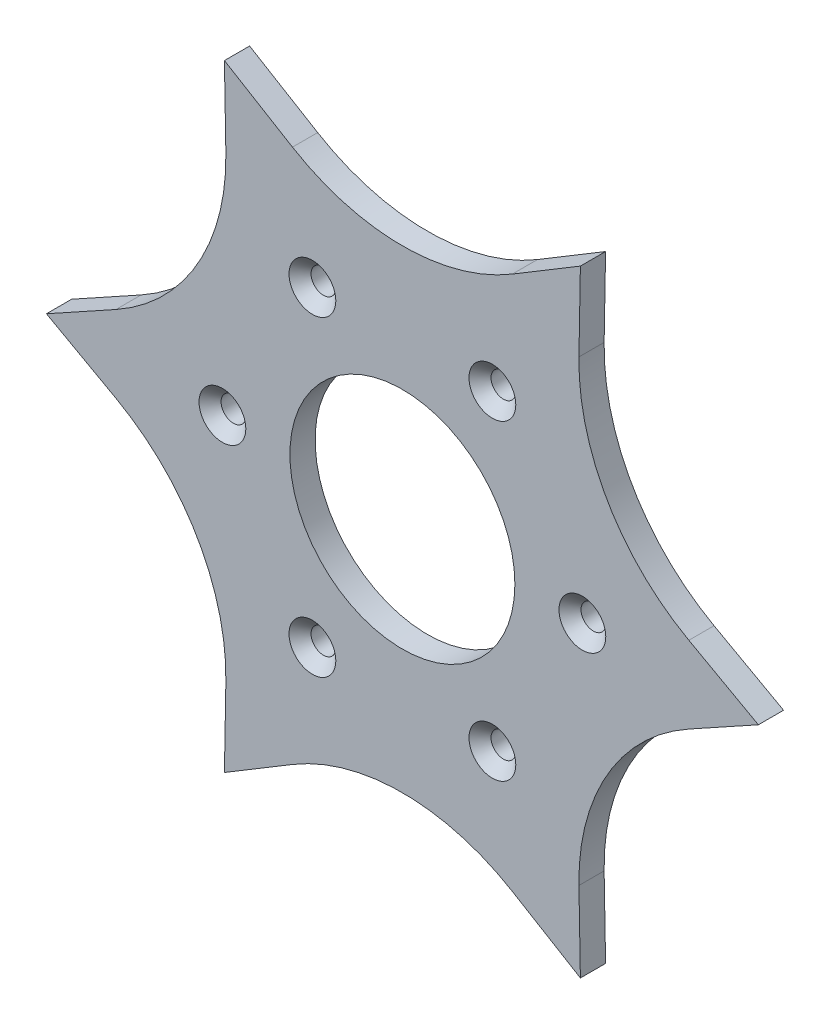
from build123d import *

# Parameters (mm, degrees)
SKETCH7_R                                       = 25
BOSS_EXTRUDE5_DEPTH                             = 5.6
CSK_FOR_M5_FLAT_HEAD_MACHINE_SCREW1_D           = 5.5
CSK_FOR_M5_FLAT_HEAD_MACHINE_SCREW1_CSINK_D     = 10.4
CSK_FOR_M5_FLAT_HEAD_MACHINE_SCREW1_CSINK_ANGLE = 90
CIRPATTERN1_COUNT                               = 6


with BuildPart() as part:
    # Sketch7 → Boss-Extrude5 (new body)
    with BuildSketch(Plane.XY.offset(62.545612614)):
        with BuildLine():
            Line((-39.235419436, -50.863989919), (-39.557386288, -68.515402865))
            Line((-39.557386288, -68.515402865), (-24.43179769, -59.410864919))
            ThreePointArc((-24.43179769, -59.410864919), (0, -52.625), (24.43179769, -59.410864919))
            Line((24.43179769, -59.410864919), (39.557386288, -68.515402865))
            Line((39.557386288, -68.515402865), (39.235419436, -50.863989919))
            ThreePointArc((39.235419436, -50.863989919), (45.574586874, -26.3125), (63.667217125, -8.546875))
            Line((63.667217125, -8.546875), (79.114772576, 0))
            Line((79.114772576, 0), (63.667217125, 8.546875))
            ThreePointArc((63.667217125, 8.546875), (45.574586874, 26.3125), (39.235419436, 50.863989919))
            Line((39.235419436, 50.863989919), (39.557386288, 68.515402865))
            Line((39.557386288, 68.515402865), (24.43179769, 59.410864919))
            ThreePointArc((24.43179769, 59.410864919), (0, 52.625), (-24.43179769, 59.410864919))
            Line((-24.43179769, 59.410864919), (-39.557386288, 68.515402865))
            Line((-39.557386288, 68.515402865), (-39.235419436, 50.863989919))
            ThreePointArc((-39.235419436, 50.863989919), (-45.574586874, 26.3125), (-63.667217125, 8.546875))
            Line((-63.667217125, 8.546875), (-79.114772576, 0))
            Line((-79.114772576, 0), (-63.667217125, -8.546875))
            ThreePointArc((-63.667217125, -8.546875), (-45.574586874, -26.3125), (-39.235419436, -50.863989919))
        make_face()
        Circle(SKETCH7_R, mode=Mode.SUBTRACT)
    extrude(amount=BOSS_EXTRUDE5_DEPTH)

    # CSK for M5 Flat Head Machine Screw1 (through all)
    with Locations(Plane.XY.offset(68.145612614)):
        with Locations((-40, 0)):
            csk_for_m5_flat_head_machine_screw1 = CounterSinkHole(CSK_FOR_M5_FLAT_HEAD_MACHINE_SCREW1_D / 2, CSK_FOR_M5_FLAT_HEAD_MACHINE_SCREW1_CSINK_D / 2, counter_sink_angle=CSK_FOR_M5_FLAT_HEAD_MACHINE_SCREW1_CSINK_ANGLE)

    # CirPattern1: CSK for M5 Flat Head Machine Screw1 ×6 about axis
    cirpattern1_axis = Axis((0, 0, 68.145612614), (0, 0, 1))
    for i in range(1, CIRPATTERN1_COUNT):
        add(csk_for_m5_flat_head_machine_screw1.rotate(cirpattern1_axis, i * 360 / CIRPATTERN1_COUNT), mode=Mode.SUBTRACT)


solid = part.part
